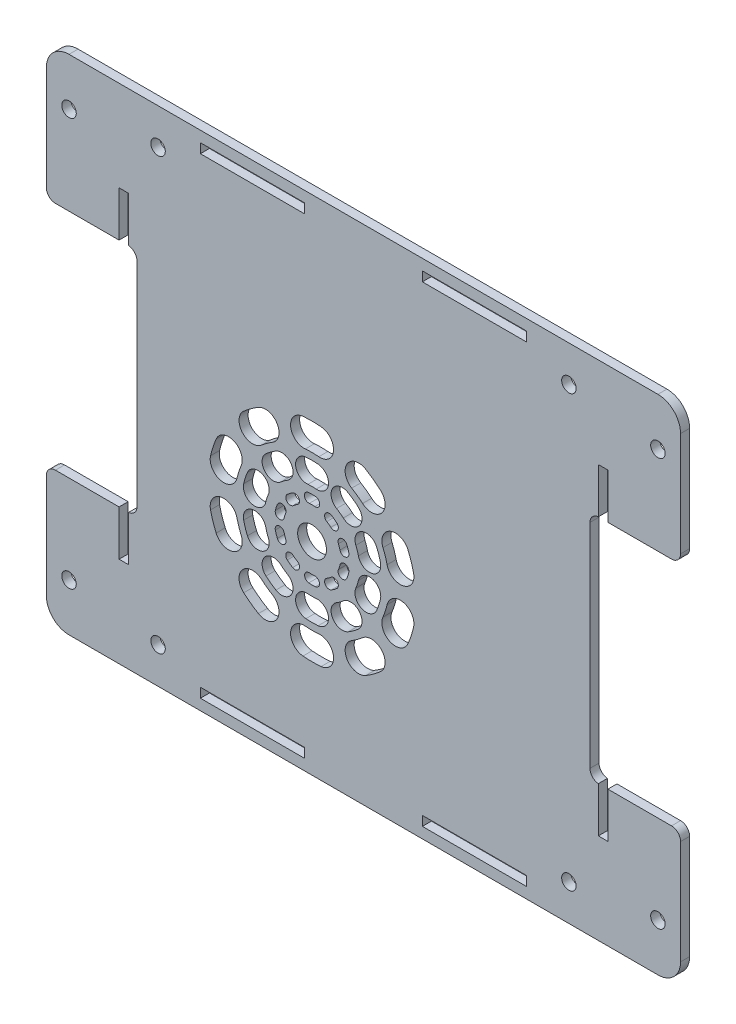
from build123d import *

# Parameters (mm, degrees)
SKETCH_1_W          = 140
SKETCH_1_H          = 111
EXTRUDE_1_DEPTH     = 2
SKETCH_2_R          = 1.6
CUT_EXTRUDE_1_DEPTH = 90.354630546
SKETCH_3_W          = 2.1
SKETCH_3_H          = 23
SKETCH_3_W_2        = 23
SKETCH_3_H_2        = 2.1
CUT_EXTRUDE_2_DEPTH = 90.354630546
SKETCH_4_R          = 3.180968653
CUT_EXTRUDE_4_DEPTH = 10
FILLET_1_R          = 5
SKETCH_5_R          = 1.6
CUT_EXTRUDE_5_DEPTH = 10
SKETCH_6_W          = 20
SKETCH_6_H          = 51
CUT_EXTRUDE_6_DEPTH = 10
FILLET_2_R          = 2
FILLET_3_R          = 2


with BuildPart() as part:
    # 草图1 → 凸台-拉伸1 (new body)
    with BuildSketch(Plane.XY):
        Rectangle(SKETCH_1_W, SKETCH_1_H)
    extrude(amount=EXTRUDE_1_DEPTH)

    # 草图2 → 切除-拉伸1 (cut, through all)
    with BuildSketch(Plane(origin=(0, 0, 0), x_dir=(-1, 0, 0), z_dir=(0, 0, -1))):
        with Locations((-45.35, -47.55)):
            Circle(SKETCH_2_R)
        with Locations((45.35, -47.55)):
            Circle(SKETCH_2_R)
        with Locations((45.35, 47.55)):
            Circle(SKETCH_2_R)
        with Locations((-45.35, 47.55)):
            Circle(SKETCH_2_R)
    extrude(amount=-CUT_EXTRUDE_1_DEPTH, mode=Mode.SUBTRACT)

    # 草图3 → 切除-拉伸2 (cut, through all)
    with BuildSketch(Plane(origin=(0, 0, 0), x_dir=(-1, 0, 0), z_dir=(0, 0, -1))):
        with Locations((-52.9, 24)):
            Rectangle(SKETCH_3_W, SKETCH_3_H)
        with Locations((-52.9, -24)):
            Rectangle(SKETCH_3_W, SKETCH_3_H)
        with Locations((52.9, -24)):
            Rectangle(SKETCH_3_W, SKETCH_3_H)
        with Locations((52.9, 24)):
            Rectangle(SKETCH_3_W, SKETCH_3_H)
        with Locations((-24.5, -52.05)):
            Rectangle(SKETCH_3_W_2, SKETCH_3_H_2)
        with Locations((24.5, -52.05)):
            Rectangle(SKETCH_3_W_2, SKETCH_3_H_2)
        with Locations((24.5, 52.05)):
            Rectangle(SKETCH_3_W_2, SKETCH_3_H_2)
        with Locations((-24.5, 52.05)):
            Rectangle(SKETCH_3_W_2, SKETCH_3_H_2)
    extrude(amount=-CUT_EXTRUDE_2_DEPTH, mode=Mode.SUBTRACT)

    # 草图4 → 切除-拉伸4 (cut)
    with BuildSketch(Plane.XY.offset(2)):
        with Locations((-11.35, -10.8)):
            Circle(SKETCH_4_R)
        with BuildLine():
            ThreePointArc((-9.345417917, 12.112478056), (-11.35, 12.2), (-13.354582083, 12.112478056))
            ThreePointArc((-13.354582083, 12.112478056), (-16.081698949, 8.862426734), (-12.831647627, 6.135309868))
            ThreePointArc((-12.831647627, 6.135309868), (-11.35, 6.2), (-9.868352373, 6.135309868))
            ThreePointArc((-9.868352373, 6.135309868), (-6.618301051, 8.862426734), (-9.345417917, 12.112478056))
        make_face()
        with BuildLine():
            ThreePointArc((-9.999085987, 4.64101782), (-11.35, 4.7), (-12.700914013, 4.64101782))
            ThreePointArc((-12.700914013, 4.64101782), (-14.973511401, 1.932641718), (-12.265135299, -0.33995567))
            ThreePointArc((-12.265135299, -0.33995567), (-11.35, -0.3), (-10.434864701, -0.33995567))
            ThreePointArc((-10.434864701, -0.33995567), (-7.726488599, 1.932641718), (-9.999085987, 4.64101782))
        make_face()
        with BuildLine():
            ThreePointArc((-10.565598315, -1.834247717), (-11.35, -1.8), (-12.134401685, -1.834247717))
            ThreePointArc((-12.134401685, -1.834247717), (-13.04344064, -2.917598158), (-11.960090199, -3.826637113))
            ThreePointArc((-11.960090199, -3.826637113), (-11.35, -3.8), (-10.739909801, -3.826637113))
            ThreePointArc((-10.739909801, -3.826637113), (-9.65655936, -2.917598158), (-10.565598315, -1.834247717))
        make_face()
        with BuildLine():
            ThreePointArc((3.739357667, 6.558320345), (2.169060803, 7.807390871), (0.495875723, 8.914847916))
            ThreePointArc((0.495875723, 8.914847916), (-3.620740404, 7.888460239), (-2.594352727, 3.771844112))
            ThreePointArc((-2.594352727, 3.771844112), (-1.357650711, 2.953288904), (-0.196996507, 2.030062864))
            ThreePointArc((-0.196996507, 2.030062864), (4.03530932, 2.326014517), (3.739357667, 6.558320345))
        make_face()
        with BuildLine():
            ThreePointArc((-1.181085051, 0.897998493), (-2.239328589, 1.739763413), (-3.366909839, 2.486093161))
            ThreePointArc((-3.366909839, 2.486093161), (-6.797423278, 1.630770096), (-5.942100213, -1.799743343))
            ThreePointArc((-5.942100213, -1.799743343), (-5.178254851, -2.305321559), (-4.461380196, -2.875549408))
            ThreePointArc((-4.461380196, -2.875549408), (-0.934458673, -2.62892303), (-1.181085051, 0.897998493))
        make_face()
        with BuildLine():
            ThreePointArc((-5.890850024, -4.519966337), (-6.458964736, -4.06806749), (-7.06430318, -3.667402714))
            ThreePointArc((-7.06430318, -3.667402714), (-8.436508555, -4.00953194), (-8.09437933, -5.381737316))
            ThreePointArc((-8.09437933, -5.381737316), (-7.63453524, -5.686101479), (-7.202968082, -6.029385497))
            ThreePointArc((-7.202968082, -6.029385497), (-5.792199472, -5.930734946), (-5.890850024, -4.519966337))
        make_face()
        with BuildLine():
            ThreePointArc((11.06051149, -5.62612575), (10.524299875, -3.692609129), (9.821611629, -1.813184045))
            ThreePointArc((9.821611629, -1.813184045), (5.887903684, -0.22386287), (4.298582509, -4.157570816))
            ThreePointArc((4.298582509, -4.157570816), (4.817960777, -5.546711096), (5.214291101, -6.975832076))
            ThreePointArc((5.214291101, -6.975832076), (8.812254459, -9.224089107), (11.06051149, -5.62612575))
        make_face()
        with BuildLine():
            ThreePointArc((3.752736004, -7.313258658), (3.391376003, -6.010236587), (2.917825229, -4.743667508))
            ThreePointArc((2.917825229, -4.743667508), (-0.360264726, -3.419233196), (-1.684699039, -6.697323151))
            ThreePointArc((-1.684699039, -6.697323151), (-1.363906579, -7.555321559), (-1.11911432, -8.438013929))
            ThreePointArc((-1.11911432, -8.438013929), (1.879188478, -10.311561455), (3.752736004, -7.313258658))
        make_face()
        with BuildLine():
            ThreePointArc((-3.242143723, -8.928153887), (-3.436138702, -8.228630591), (-3.690362945, -7.548676969))
            ThreePointArc((-3.690362945, -7.548676969), (-5.001598927, -7.018903244), (-5.531372652, -8.330139226))
            ThreePointArc((-5.531372652, -8.330139226), (-5.338251735, -8.84666458), (-5.190883853, -9.378055996))
            ThreePointArc((-5.190883853, -9.378055996), (-3.991562734, -10.127475007), (-3.242143723, -8.928153887))
        make_face()
        with BuildLine():
            ThreePointArc((9.821611629, -19.786815955), (10.524299875, -17.907390871), (11.06051149, -15.97387425))
            ThreePointArc((11.06051149, -15.97387425), (8.812254459, -12.375910893), (5.214291101, -14.624167924))
            ThreePointArc((5.214291101, -14.624167924), (4.817960777, -16.053288904), (4.298582509, -17.442429184))
            ThreePointArc((4.298582509, -17.442429184), (5.887903684, -21.37613713), (9.821611629, -19.786815955))
        make_face()
        with BuildLine():
            ThreePointArc((2.917825229, -16.856332492), (3.391376003, -15.589763413), (3.752736004, -14.286741342))
            ThreePointArc((3.752736004, -14.286741342), (1.879188478, -11.288438545), (-1.11911432, -13.161986071))
            ThreePointArc((-1.11911432, -13.161986071), (-1.363906579, -14.044678441), (-1.684699039, -14.902676849))
            ThreePointArc((-1.684699039, -14.902676849), (-0.360264726, -18.180766804), (2.917825229, -16.856332492))
        make_face()
        with BuildLine():
            ThreePointArc((-3.690362945, -14.051323031), (-3.436138702, -13.371369409), (-3.242143723, -12.671846113))
            ThreePointArc((-3.242143723, -12.671846113), (-3.991562734, -11.472524993), (-5.190883853, -12.221944004))
            ThreePointArc((-5.190883853, -12.221944004), (-5.338251735, -12.75333542), (-5.531372652, -13.269860774))
            ThreePointArc((-5.531372652, -13.269860774), (-5.001598927, -14.581096756), (-3.690362945, -14.051323031))
        make_face()
        with BuildLine():
            ThreePointArc((0.495875723, -30.514847916), (2.169060803, -29.407390871), (3.739357667, -28.158320345))
            ThreePointArc((3.739357667, -28.158320345), (4.03530932, -23.926014517), (-0.196996507, -23.630062864))
            ThreePointArc((-0.196996507, -23.630062864), (-1.357650711, -24.553288904), (-2.594352727, -25.371844112))
            ThreePointArc((-2.594352727, -25.371844112), (-3.620740404, -29.488460239), (0.495875723, -30.514847916))
        make_face()
        with BuildLine():
            ThreePointArc((-3.366909839, -24.086093161), (-2.239328589, -23.339763413), (-1.181085051, -22.497998493))
            ThreePointArc((-1.181085051, -22.497998493), (-0.934458673, -18.97107697), (-4.461380196, -18.724450592))
            ThreePointArc((-4.461380196, -18.724450592), (-5.178254851, -19.294678441), (-5.942100213, -19.800256657))
            ThreePointArc((-5.942100213, -19.800256657), (-6.797423278, -23.230770096), (-3.366909839, -24.086093161))
        make_face()
        with BuildLine():
            ThreePointArc((-7.06430318, -17.932597286), (-6.458964736, -17.53193251), (-5.890850024, -17.080033663))
            ThreePointArc((-5.890850024, -17.080033663), (-5.792199472, -15.669265054), (-7.202968082, -15.570614503))
            ThreePointArc((-7.202968082, -15.570614503), (-7.63453524, -15.913898521), (-8.09437933, -16.218262684))
            ThreePointArc((-8.09437933, -16.218262684), (-8.436508555, -17.59046806), (-7.06430318, -17.932597286))
        make_face()
        with BuildLine():
            ThreePointArc((-13.354582083, -33.712478056), (-11.35, -33.8), (-9.345417917, -33.712478056))
            ThreePointArc((-9.345417917, -33.712478056), (-6.618301051, -30.462426734), (-9.868352373, -27.735309868))
            ThreePointArc((-9.868352373, -27.735309868), (-11.35, -27.8), (-12.831647627, -27.735309868))
            ThreePointArc((-12.831647627, -27.735309868), (-16.081698949, -30.462426734), (-13.354582083, -33.712478056))
        make_face()
        with BuildLine():
            ThreePointArc((-12.700914013, -26.24101782), (-11.35, -26.3), (-9.999085987, -26.24101782))
            ThreePointArc((-9.999085987, -26.24101782), (-7.726488599, -23.532641718), (-10.434864701, -21.26004433))
            ThreePointArc((-10.434864701, -21.26004433), (-11.35, -21.3), (-12.265135299, -21.26004433))
            ThreePointArc((-12.265135299, -21.26004433), (-14.973511401, -23.532641718), (-12.700914013, -26.24101782))
        make_face()
        with BuildLine():
            ThreePointArc((-12.075233935, -19.089461805), (-11.35, -19.121126202), (-10.624766065, -19.089461805))
            ThreePointArc((-10.624766065, -19.089461805), (-9.71572711, -18.006111364), (-10.799077551, -17.097072409))
            ThreePointArc((-10.799077551, -17.097072409), (-11.35, -17.121126202), (-11.900922449, -17.097072409))
            ThreePointArc((-11.900922449, -17.097072409), (-12.98427289, -18.006111364), (-12.075233935, -19.089461805))
        make_face()
        with BuildLine():
            ThreePointArc((-26.439357667, -28.158320345), (-24.869060803, -29.407390871), (-23.195875723, -30.514847916))
            ThreePointArc((-23.195875723, -30.514847916), (-19.079259596, -29.488460239), (-20.105647273, -25.371844112))
            ThreePointArc((-20.105647273, -25.371844112), (-21.342349289, -24.553288904), (-22.503003493, -23.630062864))
            ThreePointArc((-22.503003493, -23.630062864), (-26.73530932, -23.926014517), (-26.439357667, -28.158320345))
        make_face()
        with BuildLine():
            ThreePointArc((-21.518914949, -22.497998493), (-20.460671411, -23.339763413), (-19.333090161, -24.086093161))
            ThreePointArc((-19.333090161, -24.086093161), (-15.902576722, -23.230770096), (-16.757899787, -19.800256657))
            ThreePointArc((-16.757899787, -19.800256657), (-17.521745149, -19.294678441), (-18.238619804, -18.724450592))
            ThreePointArc((-18.238619804, -18.724450592), (-21.765541327, -18.97107697), (-21.518914949, -22.497998493))
        make_face()
        with BuildLine():
            ThreePointArc((-16.809149976, -17.080033663), (-16.241035264, -17.53193251), (-15.63569682, -17.932597286))
            ThreePointArc((-15.63569682, -17.932597286), (-14.263491445, -17.59046806), (-14.60562067, -16.218262684))
            ThreePointArc((-14.60562067, -16.218262684), (-15.06546476, -15.913898521), (-15.497031918, -15.570614503))
            ThreePointArc((-15.497031918, -15.570614503), (-16.907800528, -15.669265054), (-16.809149976, -17.080033663))
        make_face()
        with BuildLine():
            ThreePointArc((-33.76051149, -15.97387425), (-33.224299875, -17.907390871), (-32.521611629, -19.786815955))
            ThreePointArc((-32.521611629, -19.786815955), (-28.587903684, -21.37613713), (-26.998582509, -17.442429184))
            ThreePointArc((-26.998582509, -17.442429184), (-27.517960777, -16.053288904), (-27.914291101, -14.624167924))
            ThreePointArc((-27.914291101, -14.624167924), (-31.512254459, -12.375910893), (-33.76051149, -15.97387425))
        make_face()
        with BuildLine():
            ThreePointArc((-26.452736004, -14.286741342), (-26.091376003, -15.589763413), (-25.617825229, -16.856332492))
            ThreePointArc((-25.617825229, -16.856332492), (-22.339735274, -18.180766804), (-21.015300961, -14.902676849))
            ThreePointArc((-21.015300961, -14.902676849), (-21.336093421, -14.044678441), (-21.58088568, -13.161986071))
            ThreePointArc((-21.58088568, -13.161986071), (-24.579188478, -11.288438545), (-26.452736004, -14.286741342))
        make_face()
        with BuildLine():
            ThreePointArc((-19.457856277, -12.671846113), (-19.263861298, -13.371369409), (-19.009637055, -14.051323031))
            ThreePointArc((-19.009637055, -14.051323031), (-17.698401073, -14.581096756), (-17.168627348, -13.269860774))
            ThreePointArc((-17.168627348, -13.269860774), (-17.361748265, -12.75333542), (-17.509116147, -12.221944004))
            ThreePointArc((-17.509116147, -12.221944004), (-18.708437266, -11.472524993), (-19.457856277, -12.671846113))
        make_face()
        with BuildLine():
            ThreePointArc((-32.521611629, -1.813184045), (-33.224299875, -3.692609129), (-33.76051149, -5.62612575))
            ThreePointArc((-33.76051149, -5.62612575), (-31.512254459, -9.224089107), (-27.914291101, -6.975832076))
            ThreePointArc((-27.914291101, -6.975832076), (-27.517960777, -5.546711096), (-26.998582509, -4.157570816))
            ThreePointArc((-26.998582509, -4.157570816), (-28.587903684, -0.22386287), (-32.521611629, -1.813184045))
        make_face()
        with BuildLine():
            ThreePointArc((-25.617825229, -4.743667508), (-26.091376003, -6.010236587), (-26.452736004, -7.313258658))
            ThreePointArc((-26.452736004, -7.313258658), (-24.579188478, -10.311561455), (-21.58088568, -8.438013929))
            ThreePointArc((-21.58088568, -8.438013929), (-21.336093421, -7.555321559), (-21.015300961, -6.697323151))
            ThreePointArc((-21.015300961, -6.697323151), (-22.339735274, -3.419233196), (-25.617825229, -4.743667508))
        make_face()
        with BuildLine():
            ThreePointArc((-19.009637055, -7.548676969), (-19.263861298, -8.228630591), (-19.457856277, -8.928153887))
            ThreePointArc((-19.457856277, -8.928153887), (-18.708437266, -10.127475007), (-17.509116147, -9.378055996))
            ThreePointArc((-17.509116147, -9.378055996), (-17.361748265, -8.84666458), (-17.168627348, -8.330139226))
            ThreePointArc((-17.168627348, -8.330139226), (-17.698401073, -7.018903244), (-19.009637055, -7.548676969))
        make_face()
        with BuildLine():
            ThreePointArc((-23.195875723, 8.914847916), (-24.869060803, 7.807390871), (-26.439357667, 6.558320345))
            ThreePointArc((-26.439357667, 6.558320345), (-26.73530932, 2.326014517), (-22.503003493, 2.030062864))
            ThreePointArc((-22.503003493, 2.030062864), (-21.342349289, 2.953288904), (-20.105647273, 3.771844112))
            ThreePointArc((-20.105647273, 3.771844112), (-19.079259596, 7.888460239), (-23.195875723, 8.914847916))
        make_face()
        with BuildLine():
            ThreePointArc((-19.333090161, 2.486093161), (-20.460671411, 1.739763413), (-21.518914949, 0.897998493))
            ThreePointArc((-21.518914949, 0.897998493), (-21.765541327, -2.62892303), (-18.238619804, -2.875549408))
            ThreePointArc((-18.238619804, -2.875549408), (-17.521745149, -2.305321559), (-16.757899787, -1.799743343))
            ThreePointArc((-16.757899787, -1.799743343), (-15.902576722, 1.630770096), (-19.333090161, 2.486093161))
        make_face()
        with BuildLine():
            ThreePointArc((-15.63569682, -3.667402714), (-16.241035264, -4.06806749), (-16.809149976, -4.519966337))
            ThreePointArc((-16.809149976, -4.519966337), (-16.907800528, -5.930734946), (-15.497031918, -6.029385497))
            ThreePointArc((-15.497031918, -6.029385497), (-15.06546476, -5.686101479), (-14.60562067, -5.381737316))
            ThreePointArc((-14.60562067, -5.381737316), (-14.263491445, -4.00953194), (-15.63569682, -3.667402714))
        make_face()
    extrude(amount=-CUT_EXTRUDE_4_DEPTH, mode=Mode.SUBTRACT)

    # 圆角1
    fillet_1_edges = [part.edges().sort_by_distance(p)[0] for p in [
        (70, -55.5, 1),
        (-70, -55.5, 1),
        (-70, 55.5, 1),
        (70, 55.5, 1),
    ]]
    fillet(fillet_1_edges, radius=FILLET_1_R)

    # 草图5 → 切除-拉伸5 (cut)
    with BuildSketch(Plane(origin=(0, 0, 0), x_dir=(-1, 0, 0), z_dir=(0, 0, -1))):
        with Locations((-65, 45)):
            Circle(SKETCH_5_R)
        with Locations((65, 45)):
            Circle(SKETCH_5_R)
        with Locations((65, -45)):
            Circle(SKETCH_5_R)
        with Locations((-65, -45)):
            Circle(SKETCH_5_R)
    extrude(amount=-CUT_EXTRUDE_5_DEPTH, mode=Mode.SUBTRACT)

    # 草图6 → 切除-拉伸6 (cut)
    with BuildSketch(Plane(origin=(0, 0, 0), x_dir=(-1, 0, 0), z_dir=(0, 0, -1))):
        with Locations((60, 0)):
            Rectangle(SKETCH_6_W, SKETCH_6_H)
    cut_extrude_6 = extrude(amount=-CUT_EXTRUDE_6_DEPTH, mode=Mode.SUBTRACT)

    # 圆角2
    # the kernel refuses this fillet: 2 mm, written as the material it adds along each edge
    with BuildSketch(Plane(origin=(-50, -25.5, 0), x_dir=(0, 1, 0), z_dir=(0, 0, 1))) as fillet_2_piece_1:
        with BuildLine():
            CenterArc((1.994367068, 2), FILLET_2_R, 184.301222305, 85.698777695)
            Line((0, 1.85), (0, 0))
            Line((0, 0), (1.994367068, 0))
        make_face()
    extrude(amount=2)
    with BuildSketch(Plane(origin=(-50, 25.5, 0), x_dir=(-1, 0, 0), z_dir=(0, 0, 1))) as fillet_2_piece_2:
        with BuildLine():
            CenterArc((2, 1.994367068), FILLET_2_R, 180, 85.698777695)
            Line((0, 1.994367068), (0, 0))
            Line((0, 0), (1.85, 0))
        make_face()
    extrude(amount=2)
    # the kernel refuses this fillet: 2 mm, written as the material it takes off along each edge
    with BuildSketch(Plane(origin=(-70, -25.5, -5), x_dir=(1, 0, 0), z_dir=(0, 0, 1)), Plane(origin=(-70, 25.5, -5), x_dir=(0, 1, 0), z_dir=(0, 0, 1))) as fillet_2_2_piece_1:
        with BuildLine():
            CenterArc((FILLET_2_R, -FILLET_2_R), FILLET_2_R, 90, 90)
            Line((0, -FILLET_2_R), (0, 0))
            Line((0, 0), (FILLET_2_R, 0))
        make_face()
    extrude(amount=12, mode=Mode.SUBTRACT)

    # 镜向1: 切除-拉伸6 across plane
    add(cut_extrude_6.mirror(Plane.ZY), mode=Mode.SUBTRACT)

    # 圆角3
    # the kernel refuses this fillet: 2 mm, written as the material it adds along each edge
    with BuildSketch(Plane(origin=(50, 25.5, 0), x_dir=(0, -1, 0), z_dir=(0, 0, 1))) as fillet_3_piece_1:
        with BuildLine():
            CenterArc((1.994367068, 2), FILLET_3_R, 184.301222305, 85.698777695)
            Line((0, 1.85), (0, 0))
            Line((0, 0), (1.994367068, 0))
        make_face()
    extrude(amount=2)
    with BuildSketch(Plane(origin=(50, -25.5, 0), x_dir=(1, 0, 0), z_dir=(0, 0, 1))) as fillet_3_piece_2:
        with BuildLine():
            CenterArc((2, 1.994367068), FILLET_3_R, 180, 85.698777695)
            Line((0, 1.994367068), (0, 0))
            Line((0, 0), (1.85, 0))
        make_face()
    extrude(amount=2)
    # the kernel refuses this fillet: 2 mm, written as the material it takes off along each edge
    with BuildSketch(Plane(origin=(70, 25.5, -5), x_dir=(-1, 0, 0), z_dir=(0, 0, 1)), Plane(origin=(70, -25.5, -5), x_dir=(0, -1, 0), z_dir=(0, 0, 1))) as fillet_3_2_piece_1:
        with BuildLine():
            CenterArc((FILLET_3_R, -FILLET_3_R), FILLET_3_R, 90, 90)
            Line((0, -FILLET_3_R), (0, 0))
            Line((0, 0), (FILLET_3_R, 0))
        make_face()
    extrude(amount=12, mode=Mode.SUBTRACT)


solid = part.part
